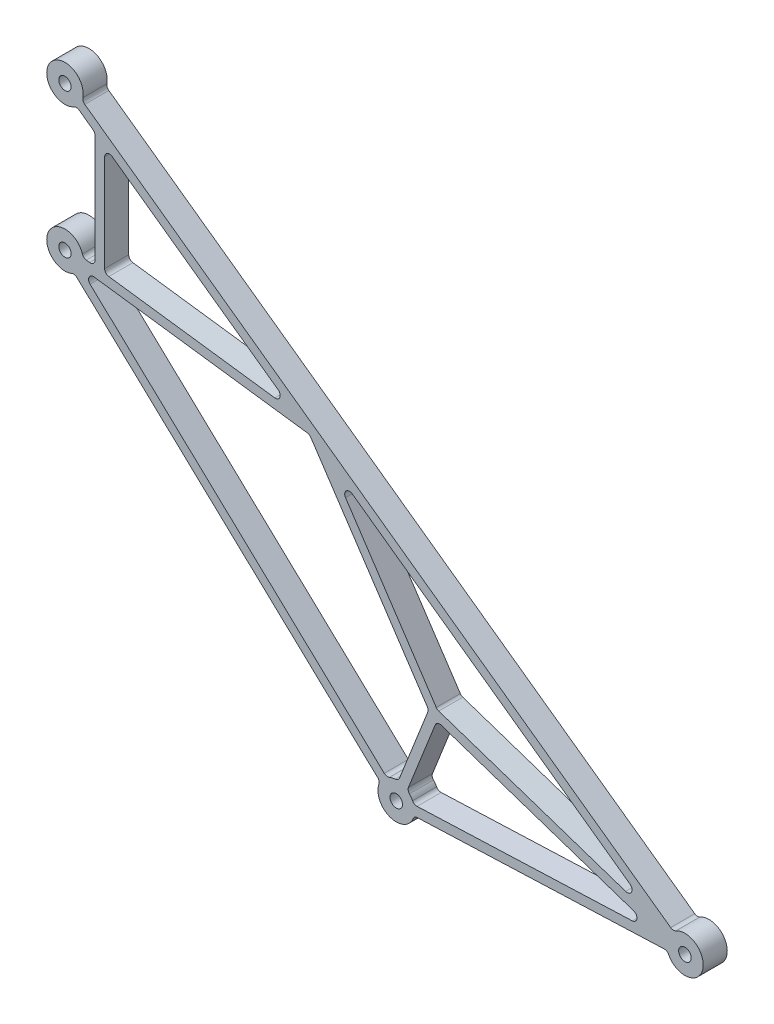
from build123d import *
from build123d.topology import SkipClean

# Parameters (mm, degrees)
SKETCH1_R               = 3.2639
SKETCH1_R_2             = 3.302
BOSS_EXTRUDE1_DEPTH     = 6.35
FILLET1_R               = 6.35
CUT_EXTRUDE1_DEPTH      = 391.591036161
CUT_EXTRUDE1_DEPTH_BACK = 391.591036161
FILLET2_R               = 2.54
FILLET3_START           = -6.35
FILLET3_DEPTH           = 12.7


with BuildPart() as part:
    # Sketch1 → Boss-Extrude1 (new, symmetric)
    with BuildSketch(Plane.XY):
        with BuildLine():
            Line((323.403565347, -23.482283069), (-3.916489287, 211.058114043))
            ThreePointArc((-3.916489287, 211.058114043), (-17.330936491, 208.842994945), (-15.115817393, 195.42854774))
            Line((-15.115817393, 195.42854774), (6.35884666, 180.040928914))
            Line((6.35884666, 180.040928914), (6.35884666, 136.657230892))
            Line((6.35884666, 136.657230892), (-9.51615334, 136.657230892))
            ThreePointArc((-9.51615334, 136.657230892), (-18.453997349, 130.584802008), (-16.101018255, 120.038573419))
            Line((-16.101018255, 120.038573419), (158.772752683, -44.352579771))
            ThreePointArc((158.772752683, -44.352579771), (161.828207487, -46.293327152), (165.383713496, -46.97206236))
            Line((165.383713496, -46.97206236), (317.781709759, -40.9800363))
            ThreePointArc((317.781709759, -40.9800363), (326.971059958, -34.280483913), (323.403565347, -23.482283069))
        make_face()
        with Locations((-9.51615334, 203.243330892)):
            Circle(SKETCH1_R, mode=Mode.SUBTRACT)
        with Locations((317.781709759, -31.3280363)):
            Circle(SKETCH1_R_2, mode=Mode.SUBTRACT)
        with Locations((165.383713496, -37.32006236)):
            Circle(SKETCH1_R_2, mode=Mode.SUBTRACT)
        with Locations((-9.51615334, 127.043330892)):
            Circle(SKETCH1_R, mode=Mode.SUBTRACT)
    extrude(amount=BOSS_EXTRUDE1_DEPTH, both=True)

    # Fillet1
    fillet1_edges = [part.edges().sort_by_distance(p)[0] for p in [
        (6.35884666, 136.657230892, 0),
        (6.35884666, 180.040928914, 0),
    ]]
    fillet(fillet1_edges, radius=FILLET1_R)

    # Sketch3 → Cut-Extrude1 (cut, two sides: drawn at the far end of the back side and taken through both)
    with SkipClean():  # the faces are left unmerged after this step: merging them gives an invalid solid
        with BuildSketch(Plane.XY.offset(-CUT_EXTRUDE1_DEPTH_BACK)):
            with BuildLine():
                ThreePointArc((3.707435863, 181.940790938), (5.657233219, 179.680529676), (6.35884666, 176.779111181))
                Line((6.35884666, 176.779111181), (6.35884666, 188.740894591))
                Line((6.35884666, 188.740894591), (-3.45918948, 195.777390763))
                ThreePointArc((-3.45918948, 195.777390763), (-9.228570931, 193.633733108), (-15.115817393, 195.42854774))
                Line((-15.115817393, 195.42854774), (3.707435863, 181.940790938))
            make_face()
            with BuildLine():
                ThreePointArc((0.09774666, 203.243330892), (-0.052851391, 201.548341381), (-0.499927425, 199.90645459))
                Line((-0.499927425, 199.90645459), (122.05229066, 112.074407425))
                Line((122.05229066, 112.074407425), (122.945240738, 111.43443832))
                Line((122.945240738, 111.43443832), (311.692641772, -23.839087438))
                ThreePointArc((311.692641772, -23.839087438), (317.487772358, -21.680513052), (323.403565347, -23.482283069))
                Line((323.403565347, -23.482283069), (-3.916489287, 211.058114043))
                ThreePointArc((-3.916489287, 211.058114043), (-0.96449609, 207.636078493), (0.09774666, 203.243330892))
            make_face()
            Polygon((111.340098755, 113.501797091), (11.43884666, 185.10010533), (11.43884666, 126.813546556), align=None)
            with BuildLine():
                Line((119.611598008, 107.274727388), (-0.660580828, 123.300884005))
                ThreePointArc((-0.660580828, 123.300884005), (-0.831975536, 122.91875466), (-1.019850221, 122.544452529))
                Line((-1.019850221, 122.544452529), (160.337493151, -29.092258022))
                ThreePointArc((160.337493151, -29.092258022), (163.280736167, -27.8999461), (166.451617397, -27.727321081))
                Line((166.451617397, -27.727321081), (182.502514914, 12.79242434))
                Line((182.502514914, 12.79242434), (119.611598008, 107.274727388))
            make_face()
            with BuildLine():
                ThreePointArc((-4.498715678, 118.842575285), (-10.501957546, 117.480106369), (-16.101018255, 120.038573419))
                Line((-16.101018255, 120.038573419), (158.772752683, -44.352579771))
                ThreePointArc((158.772752683, -44.352579771), (155.861403554, -38.896995261), (156.858627693, -32.794135266))
                Line((156.858627693, -32.794135266), (-4.498715678, 118.842575285))
            make_face()
            Polygon((302.558149165, -23.542420343), (130.90056761, 99.482989028), (186.986074503, 15.224591797), align=None)
            with BuildLine():
                Line((174.588526659, -34.416182433), (303.849770217, -29.333853537))
                Line((303.849770217, -29.333853537), (186.828441546, 9.919290292))
                Line((186.828441546, 9.919290292), (171.174562899, -29.598199426))
                ThreePointArc((171.174562899, -29.598199426), (173.259036601, -31.739704846), (174.588526659, -34.416182433))
            make_face()
            with BuildLine():
                Line((166.141541896, -46.942265856), (317.781709759, -40.9800363))
                ThreePointArc((317.781709759, -40.9800363), (312.075009533, -39.112294551), (308.576896596, -34.231916227))
                Line((308.576896596, -34.231916227), (174.788109276, -39.492260326))
                ThreePointArc((174.788109276, -39.492260326), (171.68397902, -44.632227452), (166.141541896, -46.942265856))
            make_face()
            with BuildLine():
                Line((6.35884666, 127.490451859), (6.35884666, 143.007230892))
                ThreePointArc((6.35884666, 143.007230892), (4.498974721, 138.517102831), (0.00884666, 136.657230892))
                Line((0.00884666, 136.657230892), (-9.51615334, 136.657230892))
                ThreePointArc((-9.51615334, 136.657230892), (-3.191761895, 134.284128228), (0.010393998, 128.336377306))
                Line((0.010393998, 128.336377306), (6.35884666, 127.490451859))
            make_face()
        extrude(amount=CUT_EXTRUDE1_DEPTH + CUT_EXTRUDE1_DEPTH_BACK, mode=Mode.SUBTRACT)

    # Fillet2
    # the kernel refuses this fillet: 2.54 mm, written as the material it adds along each edge
    with BuildSketch(Plane(origin=(166.451617397, -27.727321081, -6.35), x_dir=(-0.9995758399845447, 0.029122845314151255, 0), z_dir=(0, 0, 1)), Plane(origin=(160.337493151, -29.092258022, 6.35), x_dir=(0.892287076417909, 0.4514684631927024, 0), z_dir=(0, 0, -1))) as fillet2_piece_1:
        with BuildLine():
            CenterArc((1.783556305, -2.531519164), FILLET2_R, 94.683397531, 65.375681648)
            Line((-0.604157454, -1.665249573), (-0.651911729, -1.647924181))
            Line((-0.651911729, -1.647924181), (-0.047754275, 0.017325392))
            Line((-0.047754275, 0.017325392), (0.004147805, 0.050630383))
            ThreePointArc((0.004147805, 0.050630383), (0.788083018, 0.018572822), (1.572018232, 0.050630383))
            Line((1.572018232, 0.050630383), (1.576166037, 0))
        make_face()
    extrude(amount=12.7)
    with BuildSketch(Plane(origin=(-0.660580828, 123.300884005, 6.35), x_dir=(0.9912388387460753, -0.13208165868633, 0), z_dir=(0, 0, -1))) as fillet2_piece_2:
        with BuildLine():
            CenterArc((1.591611282, 2.54), FILLET2_R, 223.323691948, 46.676308052)
            Line((-0.256211052, 0.797257155), (-0.293167498, 0.762402299))
            ThreePointArc((-0.293167498, 0.762402299), (-0.167784752, 0.385877038), (-0.048994959, -0.0134214))
            Line((-0.048994959, -0.0134214), (0, -0.0508))
            Line((0, -0.0508), (1.591611282, -0.0508))
            Line((1.591611282, -0.0508), (1.591611282, 0))
        make_face()
    extrude(amount=12.7)
    with BuildSketch(Plane(origin=(119.611598008, 107.274727388, -6.35), x_dir=(0.5541066503757912, -0.8324456859215024, 0), z_dir=(0, 0, 1))) as fillet2_piece_3:
        with BuildLine():
            CenterArc((FILLET2_R * 0.453208704568, -FILLET2_R), FILLET2_R, 90, 48.760894885)
            Line((-FILLET2_R * 0.298756464993, -FILLET2_R * 0.340797160377), (-FILLET2_R * 0.313795768384, -FILLET2_R * 0.327613103585))
            Line((-FILLET2_R * 0.313795768384, -FILLET2_R * 0.327613103585), (-FILLET2_R * 0.00906417409136, FILLET2_R * 0.02))
            Line((-FILLET2_R * 0.00906417409136, FILLET2_R * 0.02), (FILLET2_R * 0.453208704568, FILLET2_R * 0.02))
            Line((FILLET2_R * 0.453208704568, FILLET2_R * 0.02), (FILLET2_R * 0.453208704568, 0))
        make_face()
    extrude(amount=12.7)
    with BuildSketch(Plane(origin=(182.502514914, 12.79242434, -6.35), x_dir=(-0.36828313872345547, -0.9297136815880468, 0), z_dir=(0, 0, 1))) as fillet2_piece_4:
        with BuildLine():
            CenterArc((FILLET2_R * 0.523442888371, -FILLET2_R), FILLET2_R, 90, 55.258978007)
            Line((-FILLET2_R * 0.29829335557, -FILLET2_R * 0.430131993008), (-FILLET2_R * 0.314728080449, -FILLET2_R * 0.418734632868))
            Line((-FILLET2_R * 0.314728080449, -FILLET2_R * 0.418734632868), (-FILLET2_R * 0.0104688577674, FILLET2_R * 0.02))
            Line((-FILLET2_R * 0.0104688577674, FILLET2_R * 0.02), (FILLET2_R * 0.523442888371, FILLET2_R * 0.02))
            Line((FILLET2_R * 0.523442888371, FILLET2_R * 0.02), (FILLET2_R * 0.523442888371, 0))
        make_face()
    extrude(amount=12.7)
    with BuildSketch(Plane(origin=(156.858627693, -32.794135266, 6.35), x_dir=(-0.3952284110607686, -0.9185828776383654, 0), z_dir=(0, 0, -1)), Plane(origin=(308.576896596, -34.231916227, 6.35), x_dir=(0.37772010678860757, -0.925919824243764, 0), z_dir=(0, 0, -1)), Plane(origin=(174.588526659, -34.416182433, 6.35), x_dir=(-0.37772010678857665, 0.9259198242437766, 0), z_dir=(0, 0, -1))) as fillet2_piece_5:
        with BuildLine():
            CenterArc((1.783556305, 2.531519164), FILLET2_R, 199.940920821, 65.375681648)
            Line((-0.604157454, 1.665249573), (-0.651911729, 1.647924181))
            Line((-0.651911729, 1.647924181), (-0.047754275, -0.017325392))
            Line((-0.047754275, -0.017325392), (0.004147805, -0.050630383))
            ThreePointArc((0.004147805, -0.050630383), (0.788083018, -0.018572822), (1.572018232, -0.050630383))
            Line((1.572018232, -0.050630383), (1.576166037, 0))
        make_face()
    extrude(amount=12.7)
    with BuildSketch(Plane(origin=(-4.498715678, 118.842575285, 6.35), x_dir=(-0.8928548726360307, -0.45034450858214903, 0), z_dir=(0, 0, -1))) as fillet2_piece_6:
        with BuildLine():
            CenterArc((1.78119788, -2.531482193), FILLET2_R, 94.693600353, 65.293330113)
            Line((-0.605423151, -1.662206603), (-0.653155572, -1.644821091))
            Line((-0.653155572, -1.644821091), (-0.047732421, 0.017385512))
            Line((-0.047732421, 0.017385512), (0.004156821, 0.050629644))
            ThreePointArc((0.004156821, 0.050629644), (0.78667841, 0.018560101), (1.5692, 0.050629644))
            Line((1.5692, 0.050629644), (1.573356821, 0))
        make_face()
    extrude(amount=12.7)
    with BuildSketch(Plane(origin=(311.692641772, -23.839087438, 6.35), x_dir=(-0.812807839950294, 0.5825319006847067, 0), z_dir=(0, 0, -1)), Plane(origin=(174.788109276, -39.492260326, 6.35), x_dir=(0.9992279317494391, 0.03928791686687304, 0), z_dir=(0, 0, -1)), Plane(origin=(171.174562899, -29.598199426, 6.35), x_dir=(0.36828313872344726, 0.92971368158805, 0), z_dir=(0, 0, -1))) as fillet2_piece_7:
        with BuildLine():
            CenterArc((1.771457696, 2.54), FILLET2_R, 204.624318352, 65.375681648)
            Line((-0.537553035, 1.481666667), (-0.583733249, 1.4605))
            ThreePointArc((-0.583733249, 1.4605), (-0.286235802, 0.734499053), (-0.049009441, -0.013368421))
            Line((-0.049009441, -0.013368421), (0, -0.0508))
            Line((0, -0.0508), (1.771457696, -0.0508))
            Line((1.771457696, -0.0508), (1.771457696, 0))
        make_face()
    extrude(amount=12.7)
    with BuildSketch(Plane(origin=(-0.499927425, 199.90645459, 6.35), x_dir=(0.26918459485658613, 0.9630886012677626, 0), z_dir=(0, 0, -1)), Plane(origin=(0.010393998, 128.336377306, 6.35), x_dir=(-0.21513026066019494, 0.97658536285789, 0), z_dir=(0, 0, -1))) as fillet2_piece_8:
        with BuildLine():
            CenterArc((1.78119788, 2.531482193), FILLET2_R, 200.013069534, 65.293330113)
            Line((-0.605423151, 1.662206603), (-0.653155572, 1.644821091))
            Line((-0.653155572, 1.644821091), (-0.047732421, -0.017385512))
            Line((-0.047732421, -0.017385512), (0.004156821, -0.050629644))
            ThreePointArc((0.004156821, -0.050629644), (0.78667841, -0.018560101), (1.5692, -0.050629644))
            Line((1.5692, -0.050629644), (1.573356821, 0))
        make_face()
    extrude(amount=12.7)
    with BuildSketch(Plane(origin=(11.43884666, 185.10010533, -6.35), x_dir=(0, -1, 0), z_dir=(0, 0, 1))) as fillet2_piece_9:
        with BuildLine():
            CenterArc((FILLET2_R * 1.94699389315, FILLET2_R), FILLET2_R, 144.371179201, 125.628820799)
            Line((FILLET2_R * 1.1341860532, FILLET2_R * 1.58253190068), (FILLET2_R * 1.1179298964, FILLET2_R * 1.5941825387))
            Line((FILLET2_R * 1.1179298964, FILLET2_R * 1.5941825387), (-FILLET2_R * 0.016256156799, FILLET2_R * 0.0116506380137))
            Line((-FILLET2_R * 0.016256156799, FILLET2_R * 0.0116506380137), (0, -FILLET2_R * 0.02))
            Line((0, -FILLET2_R * 0.02), (FILLET2_R * 1.94699389315, -FILLET2_R * 0.02))
            Line((FILLET2_R * 1.94699389315, -FILLET2_R * 0.02), (FILLET2_R * 1.94699389315, 0))
        make_face()
    extrude(amount=12.7)
    with BuildSketch(Plane(origin=(111.340098755, 113.501797091, 6.35), x_dir=(-0.9912388387460684, 0.13208165868638097, 0), z_dir=(0, 0, -1))) as fillet2_piece_10:
        with BuildLine():
            CenterArc((FILLET2_R * 4.00498548007, FILLET2_R), FILLET2_R, 118.038920786, 151.961079214)
            Line((FILLET2_R * 3.53491424299, FILLET2_R * 1.88262847908), (FILLET2_R * 3.52551281825, FILLET2_R * 1.90028104866))
            Line((FILLET2_R * 3.52551281825, FILLET2_R * 1.90028104866), (-FILLET2_R * 0.00940142474147, FILLET2_R * 0.0176525695815))
            Line((-FILLET2_R * 0.00940142474147, FILLET2_R * 0.0176525695815), (0, -FILLET2_R * 0.02))
            Line((0, -FILLET2_R * 0.02), (FILLET2_R * 4.00498548007, -FILLET2_R * 0.02))
            Line((FILLET2_R * 4.00498548007, -FILLET2_R * 0.02), (FILLET2_R * 4.00498548007, 0))
        make_face()
    extrude(amount=12.7)
    with BuildSketch(Plane(origin=(11.43884666, 126.813546556, 6.35), x_dir=(0, 1, 0), z_dir=(0, 0, -1))) as fillet2_piece_11:
        with BuildLine():
            CenterArc((FILLET2_R * 0.875589522311, FILLET2_R), FILLET2_R, 187.589900013, 82.410099987)
            Line((-FILLET2_R * 0.115649316435, FILLET2_R * 0.867918341314), (-FILLET2_R * 0.13547409321, FILLET2_R * 0.86527670814))
            Line((-FILLET2_R * 0.13547409321, FILLET2_R * 0.86527670814), (-FILLET2_R * 0.0175117904462, -FILLET2_R * 0.02))
            Line((-FILLET2_R * 0.0175117904462, -FILLET2_R * 0.02), (FILLET2_R * 0.875589522311, -FILLET2_R * 0.02))
            Line((FILLET2_R * 0.875589522311, -FILLET2_R * 0.02), (FILLET2_R * 0.875589522311, 0))
        make_face()
    extrude(amount=12.7)
    with BuildSketch(Plane(origin=(6.35884666, 127.490451859, -6.35), x_dir=(-0.9912388387460678, 0.13208165868638616, 0), z_dir=(0, 0, 1))) as fillet2_piece_12:
        with BuildLine():
            CenterArc((FILLET2_R * 1.14208767296, -FILLET2_R), FILLET2_R, 90, 97.589900013)
            Line((FILLET2_R * 0.150848834209, -FILLET2_R * 1.13208165869), (FILLET2_R * 0.131024057434, -FILLET2_R * 1.13472329186))
            Line((FILLET2_R * 0.131024057434, -FILLET2_R * 1.13472329186), (-FILLET2_R * 0.0228417534591, FILLET2_R * 0.02))
            Line((-FILLET2_R * 0.0228417534591, FILLET2_R * 0.02), (FILLET2_R * 1.14208767296, FILLET2_R * 0.02))
            Line((FILLET2_R * 1.14208767296, FILLET2_R * 0.02), (FILLET2_R * 1.14208767296, 0))
        make_face()
    extrude(amount=12.7)
    with BuildSketch(Plane(origin=(130.90056761, 99.482989028, 6.35), x_dir=(0.8128078399502843, -0.5825319006847207, 0), z_dir=(0, 0, -1))) as fillet2_piece_13:
        with BuildLine():
            CenterArc((FILLET2_R * 5.46954418313, FILLET2_R), FILLET2_R, 110.721974099, 159.278025901)
            Line((FILLET2_R * 5.11571060351, FILLET2_R * 1.93530839723), (FILLET2_R * 5.10863393191, FILLET2_R * 1.95401456518))
            Line((FILLET2_R * 5.10863393191, FILLET2_R * 1.95401456518), (-FILLET2_R * 0.00707667159249, FILLET2_R * 0.0187061679446))
            Line((-FILLET2_R * 0.00707667159249, FILLET2_R * 0.0187061679446), (0, -FILLET2_R * 0.02))
            Line((0, -FILLET2_R * 0.02), (FILLET2_R * 5.46954418313, -FILLET2_R * 0.02))
            Line((FILLET2_R * 5.46954418313, -FILLET2_R * 0.02), (FILLET2_R * 5.46954418313, 0))
        make_face()
    extrude(amount=12.7)
    with BuildSketch(Plane(origin=(302.558149165, -23.542420343, -6.35), x_dir=(-0.8128078399502848, 0.5825319006847195, 0), z_dir=(0, 0, 1))) as fillet2_piece_14:
        with BuildLine():
            CenterArc((FILLET2_R * 6.65716498575, FILLET2_R), FILLET2_R, 107.08552386, 162.91447614)
            Line((FILLET2_R * 6.36336615702, FILLET2_R * 1.95586727543), (FILLET2_R * 6.35749018045, FILLET2_R * 1.97498462094))
            Line((FILLET2_R * 6.35749018045, FILLET2_R * 1.97498462094), (-FILLET2_R * 0.00587597657447, FILLET2_R * 0.0191173455086))
            Line((-FILLET2_R * 0.00587597657447, FILLET2_R * 0.0191173455086), (0, -FILLET2_R * 0.02))
            Line((0, -FILLET2_R * 0.02), (FILLET2_R * 6.65716498575, -FILLET2_R * 0.02))
            Line((FILLET2_R * 6.65716498575, -FILLET2_R * 0.02), (FILLET2_R * 6.65716498575, 0))
        make_face()
    extrude(amount=12.7)
    with BuildSketch(Plane(origin=(186.986074503, 15.224591797, 6.35), x_dir=(-0.5541066503758183, 0.8324456859214845, 0), z_dir=(0, 0, -1))) as fillet2_piece_15:
        with BuildLine():
            CenterArc((FILLET2_R * 0.34244962946, FILLET2_R), FILLET2_R, 232.192502041, 37.807497959)
            Line((-FILLET2_R * 0.270560821853, FILLET2_R * 0.209925201908), (-FILLET2_R * 0.282821030879, FILLET2_R * 0.194123705946))
            Line((-FILLET2_R * 0.282821030879, FILLET2_R * 0.194123705946), (-FILLET2_R * 0.00684899258921, -FILLET2_R * 0.02))
            Line((-FILLET2_R * 0.00684899258921, -FILLET2_R * 0.02), (FILLET2_R * 0.34244962946, -FILLET2_R * 0.02))
            Line((FILLET2_R * 0.34244962946, -FILLET2_R * 0.02), (FILLET2_R * 0.34244962946, 0))
        make_face()
    extrude(amount=12.7)
    with BuildSketch(Plane(origin=(186.828441546, 9.919290292, -6.35), x_dir=(0.9480836055378145, -0.31802118940475943, 0), z_dir=(0, 0, 1))) as fillet2_piece_16:
        with BuildLine():
            CenterArc((FILLET2_R * 0.947862650308, -FILLET2_R), FILLET2_R, 90, 86.933524034)
            Line((-FILLET2_R * 0.0507054908644, -FILLET2_R * 0.946505444805), (-FILLET2_R * 0.0706768536878, -FILLET2_R * 0.945435553701))
            Line((-FILLET2_R * 0.0706768536878, -FILLET2_R * 0.945435553701), (-FILLET2_R * 0.0189572530062, FILLET2_R * 0.02))
            Line((-FILLET2_R * 0.0189572530062, FILLET2_R * 0.02), (FILLET2_R * 0.947862650308, FILLET2_R * 0.02))
            Line((FILLET2_R * 0.947862650308, FILLET2_R * 0.02), (FILLET2_R * 0.947862650308, 0))
        make_face()
    extrude(amount=12.7)
    with BuildSketch(Plane(origin=(303.849770217, -29.333853537, -6.35), x_dir=(-0.9480836055378152, 0.3180211894047567, 0), z_dir=(0, 0, 1))) as fillet2_piece_17:
        with BuildLine():
            CenterArc((FILLET2_R * 5.44993537278, FILLET2_R), FILLET2_R, 110.794908257, 159.205091743)
            Line((FILLET2_R * 5.09491148757, FILLET2_R * 1.93485723024), (FILLET2_R * 5.08781100986, FILLET2_R * 1.95355437484))
            Line((FILLET2_R * 5.08781100986, FILLET2_R * 1.95355437484), (-FILLET2_R * 0.00710047770437, FILLET2_R * 0.0186971446047))
            Line((-FILLET2_R * 0.00710047770437, FILLET2_R * 0.0186971446047), (0, -FILLET2_R * 0.02))
            Line((0, -FILLET2_R * 0.02), (FILLET2_R * 5.44993537278, -FILLET2_R * 0.02))
            Line((FILLET2_R * 5.44993537278, -FILLET2_R * 0.02), (FILLET2_R * 5.44993537278, 0))
        make_face()
    extrude(amount=12.7)
    with BuildSketch(Plane(origin=(-3.45918948, 195.777390763, 6.35), x_dir=(0.8128078399502832, -0.5825319006847222, 0), z_dir=(0, 0, -1))) as fillet2_piece_18:
        with BuildLine():
            CenterArc((1.769030238, 2.54), FILLET2_R, 204.706669887, 65.293330113)
            Line((-0.53845696, 1.478349007), (-0.584606704, 1.457115987))
            ThreePointArc((-0.584606704, 1.457115987), (-0.286667821, 0.732822597), (-0.048994959, -0.0134214))
            Line((-0.048994959, -0.0134214), (0, -0.0508))
            Line((0, -0.0508), (1.769030238, -0.0508))
            Line((1.769030238, -0.0508), (1.769030238, 0))
        make_face()
    extrude(amount=12.7)
    with BuildSketch(Plane(origin=(6.35884666, 188.740894591, 6.35), x_dir=(0, -1, 0), z_dir=(0, 0, -1))) as fillet2_piece_19:
        with BuildLine():
            CenterArc((FILLET2_R * 0.51361229407, FILLET2_R), FILLET2_R, 215.628820799, 54.371179201)
            Line((-FILLET2_R * 0.29919554588, FILLET2_R * 0.417468099315), (-FILLET2_R * 0.315451702679, FILLET2_R * 0.405817461302))
            Line((-FILLET2_R * 0.315451702679, FILLET2_R * 0.405817461302), (-FILLET2_R * 0.0102722458814, -FILLET2_R * 0.02))
            Line((-FILLET2_R * 0.0102722458814, -FILLET2_R * 0.02), (FILLET2_R * 0.51361229407, -FILLET2_R * 0.02))
            Line((FILLET2_R * 0.51361229407, -FILLET2_R * 0.02), (FILLET2_R * 0.51361229407, 0))
        make_face()
    extrude(amount=12.7)

    # Fillet3: read off the stored shape, not the designer's step
    # Fillet3 outline → Fillet3 (add)
    with SkipClean():  # the faces are left unmerged after this step: merging them gives an invalid solid
        with BuildSketch(Plane.XY.offset(FILLET3_START)):
            with BuildLine():
                Line((-1.019850221, 122.544452529), (3.74248631, 118.069012918))
                ThreePointArc((3.74248631, 118.069012918), (3.18755238, 121.009667849), (5.817406452, 122.43769819))
                Line((5.817406452, 122.43769819), (0.917086091, 123.090661347))
                ThreePointArc((0.917086091, 123.090661347), (-0.107785568, 123.017572006), (-1.019850221, 122.544452529))
            make_face()
        extrude(amount=FILLET3_DEPTH)


solid = part.part
